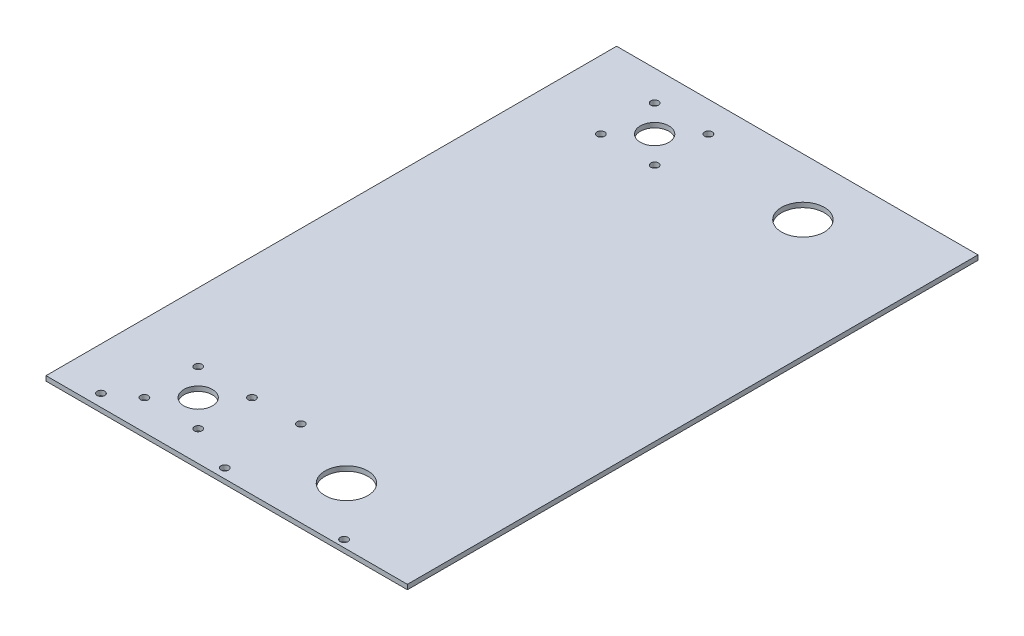
from build123d import *

# Parameters (mm, degrees)
SKETCH1_W           = 241.3
SKETCH1_H           = 381
BOSS_EXTRUDE1_DEPTH = 3.175
SKETCH7_R           = 14.2875
SKETCH7_R_2         = 9.525
SKETCH7_R_3         = 2.5527
AXLE_HOLES_DEPTH    = 226.514418885
SKETCH10_R          = 2.5527
CUT_EXTRUDE5_DEPTH  = 226.514418885


with BuildPart() as part:
    # Sketch1 → Boss-Extrude1 (new body)
    with BuildSketch(Plane(origin=(0, 0, 0), x_dir=(1, 0, 0), z_dir=(0, 1, 0))):
        Rectangle(SKETCH1_W, SKETCH1_H)
    extrude(amount=BOSS_EXTRUDE1_DEPTH)

    # Sketch7 → Axle Holes (cut, through all)
    with BuildSketch(Plane(origin=(0, 3.175, 0), x_dir=(1, 0, 0), z_dir=(0, 1, 0))):
        with Locations((41.8592, -152.4)):
            Circle(SKETCH7_R)
        with Locations((41.8592, 152.4)):
            Circle(SKETCH7_R)
        with Locations((-57.15, 152.4)):
            Circle(SKETCH7_R_2)
        with Locations((-57.15, -152.4)):
            Circle(SKETCH7_R_2)
        with Locations((-75.110512242, 170.360512242)):
            Circle(SKETCH7_R_3)
        with Locations((-39.189487758, 170.360512242)):
            Circle(SKETCH7_R_3)
        with Locations((-39.189487758, 134.439487758)):
            Circle(SKETCH7_R_3)
        with Locations((-75.110512242, 134.439487758)):
            Circle(SKETCH7_R_3)
        with Locations((-75.110512242, -134.439487758)):
            Circle(SKETCH7_R_3)
        with Locations((-39.189487758, -134.439487758)):
            Circle(SKETCH7_R_3)
        with Locations((-39.189487758, -170.360512242)):
            Circle(SKETCH7_R_3)
        with Locations((-75.110512242, -170.360512242)):
            Circle(SKETCH7_R_3)
    extrude(amount=-AXLE_HOLES_DEPTH, mode=Mode.SUBTRACT)

    # Sketch10 → Cut-Extrude5 (cut, through all)
    with BuildSketch(Plane(origin=(0, 3.175, 0), x_dir=(1, 0, 0), z_dir=(0, 1, 0))):
        with Locations((-7.6454, -133.35)):
            Circle(SKETCH10_R)
        with Locations((-92.075, -182.394929259)):
            Circle(SKETCH10_R)
        with Locations((-7.6454, -184.15)):
            Circle(SKETCH10_R)
        with Locations((73.6092, -185.7375)):
            Circle(SKETCH10_R)
    extrude(amount=-CUT_EXTRUDE5_DEPTH, mode=Mode.SUBTRACT)


solid = part.part
